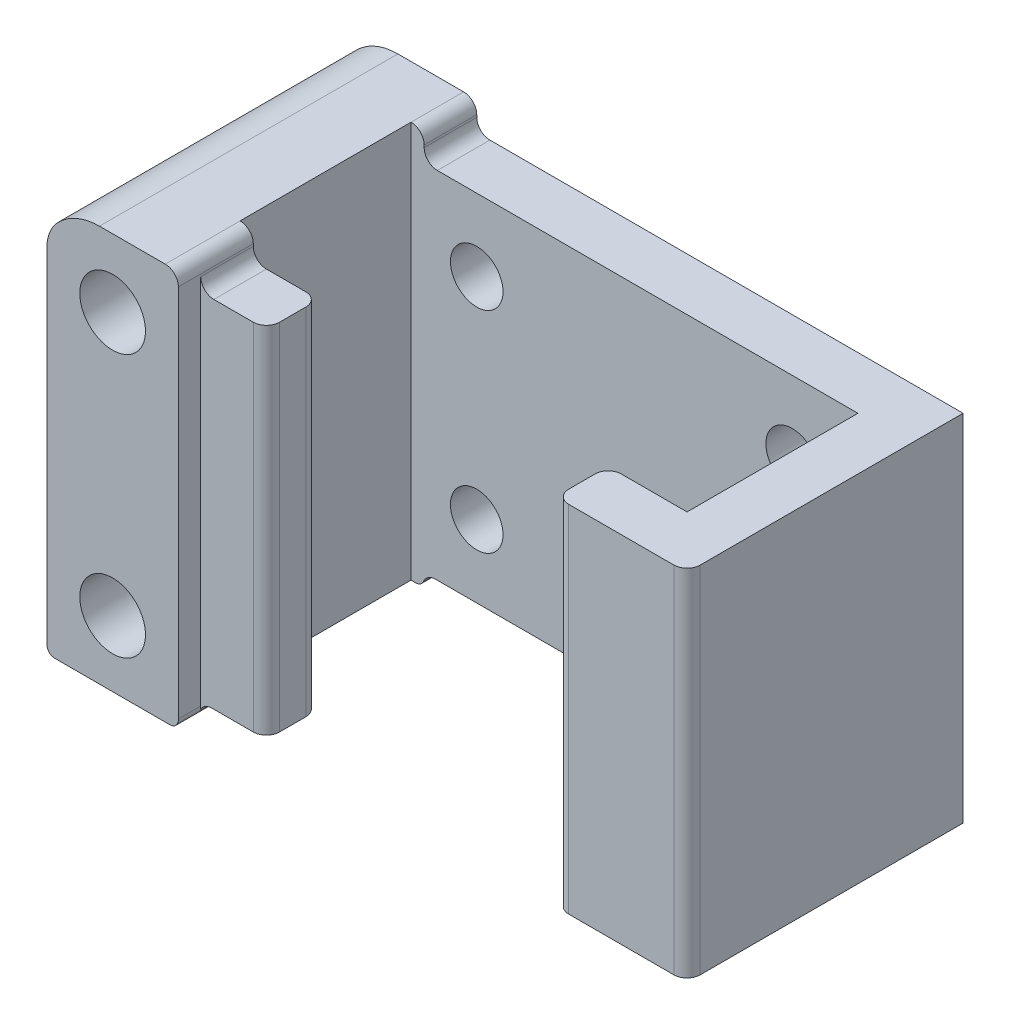
from build123d import *
from OCP.BRepAlgoAPI import BRepAlgoAPI_Cut
from OCP.TopTools import TopTools_ListOfShape

# Parameters (mm, degrees)
EXTRUDE_1_DEPTH          = 13.5
FILLET_1_R               = 0.5
CUT_EXTRUDE_1_DEPTH      = 2
CUT_EXTRUDE_1_DEPTH_BACK = 3.5
SKETCH_2_R               = 1
EXTRUDE_3_DEPTH          = 11.35
CUT_EXTRUDE_START        = -15.085786
SKETCH_14_W              = 17
SKETCH_14_H              = 6.5
CUT_EXTRUDE_7_DEPTH      = 15.085786
CUT_EXTRUDE_8_DEPTH      = 2
CUT_EXTRUDE_8_DEPTH_BACK = 15.5
SKETCH_15_R              = 1.150968548
SKETCH_15_R_2            = 1.118586154
FILLET_2_R               = 0.5
FILLET_START             = -5.25
FILLET_3_DEPTH           = 12.25
FILLET_START_2           = 3.25
FILLET_3_2_DEPTH         = 2
SKETCH_16_R              = 1.25
CUT_EXTRUDE_9_DEPTH      = 23.596980066
CHAMFER_2_SIZE           = 1.25


with BuildPart() as part:
    # 草图1 → 凸台-拉伸1 (new body)
    with BuildSketch(Plane(origin=(0, 0, 0), x_dir=(1, 0, 0), z_dir=(0, 1, 0))):
        Polygon((-5.5, -3.25), (-5.5, -5.25), (-10.5, -5.25), (-10.5, 5.25), (10.5, 5.25), (10.5, -5.25), (5.5, -5.25), (5.5, -3.25), (8.5, -3.25), (8.5, 3.25), (-8.5, 3.25), (-8.5, -3.25), align=None)
    extrude(amount=EXTRUDE_1_DEPTH)

    # 圆角1
    fillet_1_edges = [part.edges().sort_by_distance(p)[0] for p in [
        (-5.5, 6.75, 3.25),
        (-5.5, 6.75, 5.25),
        (-10.5, 6.75, 5.25),
        (10.5, 6.75, 5.25),
        (5.5, 6.75, 5.25),
        (5.5, 6.75, 3.25),
    ]]
    fillet(fillet_1_edges, radius=FILLET_1_R)

    # 草图2 → 切除-拉伸1 (cut, two sides: drawn at the far end of the back side and taken through both)
    with BuildSketch(Plane(origin=(0, 0, -5.25), x_dir=(-1, 0, 0), z_dir=(0, 0, -1)).offset(-CUT_EXTRUDE_1_DEPTH_BACK)):
        with Locations(Location((-6, 10.75, 0), (0, 0, 180))):
            Circle(SKETCH_2_R)
        with Locations(Location((6, 10.75, 0), (0, 0, 180))):
            Circle(SKETCH_2_R)
        with Locations(Location((6, 2.75, 0), (0, 0, 180))):
            Circle(SKETCH_2_R)
        with Locations(Location((-6, 2.75, 0), (0, 0, 180))):
            Circle(SKETCH_2_R)
    extrude(amount=CUT_EXTRUDE_1_DEPTH + CUT_EXTRUDE_1_DEPTH_BACK, mode=Mode.SUBTRACT)

    # 草图13 → 凸台-拉伸3 (add)
    with BuildSketch(Plane(origin=(0, 0, -5.25), x_dir=(-1, 0, 0), z_dir=(0, 0, -1))):
        with BuildLine():
            Line((7.999, -0.142846655), (7.999, 14.588591487))
            Line((7.999, 14.588591487), (10.999, 14.588591487))
            ThreePointArc((10.999, 14.588591487), (11.843623199, 14.420585487), (12.559660172, 13.942144877))
            ThreePointArc((12.559660172, 13.942144877), (12.884819299, 13.455509854), (12.999, 12.881484706))
            Line((12.999, 12.881484706), (12.999, -0.197194951))
            ThreePointArc((12.999, -0.197194951), (12.911132034, -0.409326985), (12.699, -0.497194951))
            Line((12.699, -0.497194951), (8.299, -0.497194951))
            ThreePointArc((8.299, -0.497194951), (8.075612065, -0.382152837), (7.999, -0.142846655))
        make_face()
    extrude(amount=-EXTRUDE_3_DEPTH)


with BuildPart() as cut_extrude_7_tool:
    # 草图14 → 切除-拉伸7 (new body)
    with BuildSketch(Plane.XZ.offset(0.497194951).offset(CUT_EXTRUDE_START)):
        Rectangle(SKETCH_14_W, SKETCH_14_H)
    extrude(amount=CUT_EXTRUDE_7_DEPTH)


with BuildPart() as part_1:
    add(part.part)

    # 切除-拉伸7: cut by cut_extrude_7_tool, with a tolerance
    cut_extrude_7_stock = TopTools_ListOfShape()
    cut_extrude_7_stock.Append(part_1.part.wrapped)
    cut_extrude_7_tools = TopTools_ListOfShape()
    cut_extrude_7_tools.Append(cut_extrude_7_tool.part.wrapped)
    cut_extrude_7_cut = BRepAlgoAPI_Cut()
    cut_extrude_7_cut.SetArguments(cut_extrude_7_stock)
    cut_extrude_7_cut.SetTools(cut_extrude_7_tools)
    cut_extrude_7_cut.SetFuzzyValue(0.00001)
    cut_extrude_7_cut.Build()
    add(Compound.cast(cut_extrude_7_cut.Shape()).solids(), mode=Mode.REPLACE)

    # 草图15 → 切除-拉伸8 (cut, two sides: drawn at the far end of the back side and taken through both)
    with BuildSketch(Plane.XY.offset(6.1).offset(-CUT_EXTRUDE_8_DEPTH_BACK)):
        with Locations(Location((-10.499, 12.002805049, 0), (0, 0, 180))):
            Circle(SKETCH_15_R)
        with Locations(Location((-10.499, 2.002805049, 0), (0, 0, 180))):
            Circle(SKETCH_15_R_2)
    extrude(amount=CUT_EXTRUDE_8_DEPTH + CUT_EXTRUDE_8_DEPTH_BACK, mode=Mode.SUBTRACT)

    # 圆角2
    fillet_2_edges = [part_1.edges().sort_by_distance(p)[0] for p in [
        (-7.999, 14.588591487, -4.25),
        (-7.999, 13.5, -4.25),
        (-7.999, 0, -4.25),
    ]]
    fillet(fillet_2_edges, radius=FILLET_2_R)

    # 圆角3: read off the stored shape, not the designer's step
    # 圆角3 outline → 圆角3 (cut)
    with BuildSketch(Plane.XY.offset(FILLET_START)):
        with BuildLine():
            Line((-7.999, 14.588591487), (-8.499, 14.588591487))
            ThreePointArc((-8.499, 14.588591487), (-8.14544661, 14.442144878), (-7.999, 14.088591487))
            Line((-7.999, 14.088591487), (-7.999, 14.588591487))
        make_face()
    extrude(amount=FILLET_3_DEPTH, mode=Mode.SUBTRACT)

    # Fillet 3 2 outline → Fillet 3 2 (add)
    with BuildSketch(Plane.XY.offset(FILLET_START_2)):
        with BuildLine():
            Line((-7.566440116, 0), (-7.999, 0))
            Line((-7.999, 0), (-7.999, -0.142846655))
            ThreePointArc((-7.999, -0.142846655), (-8.00224868, -0.223440354), (-8.025050148, -0.300809542))
            ThreePointArc((-8.025050148, -0.300809542), (-7.840670649, -0.081911954), (-7.566440116, 0))
        make_face()
        with BuildLine():
            ThreePointArc((-7.499, 13.5), (-7.852553391, 13.646446609), (-7.999, 14))
            Line((-7.999, 14), (-7.999, 13.5))
            Line((-7.999, 13.5), (-7.499, 13.5))
        make_face()
    extrude(amount=FILLET_3_2_DEPTH)

    # 草图16 → 切除-拉伸9 (cut, through all)
    with BuildSketch(Plane(origin=(0, 0, -5.25), x_dir=(-1, 0, 0), z_dir=(0, 0, -1))):
        with Locations((10.499, 12.002805049)):
            Circle(SKETCH_16_R)
        with Locations((10.499, 2.002805049)):
            Circle(SKETCH_16_R)
    extrude(amount=-CUT_EXTRUDE_9_DEPTH, mode=Mode.SUBTRACT)

    # 倒角2
    chamfer_2_edges = [part_1.edges().sort_by_distance(p)[0] for p in [
        (-9.249, 12.002805049, -5.25),
        (-9.249, 2.002805049, -5.25),
    ]]
    chamfer(chamfer_2_edges, length=CHAMFER_2_SIZE - 0.0001)  # a hair under: the kernel refuses the full size


solid = part_1.part
